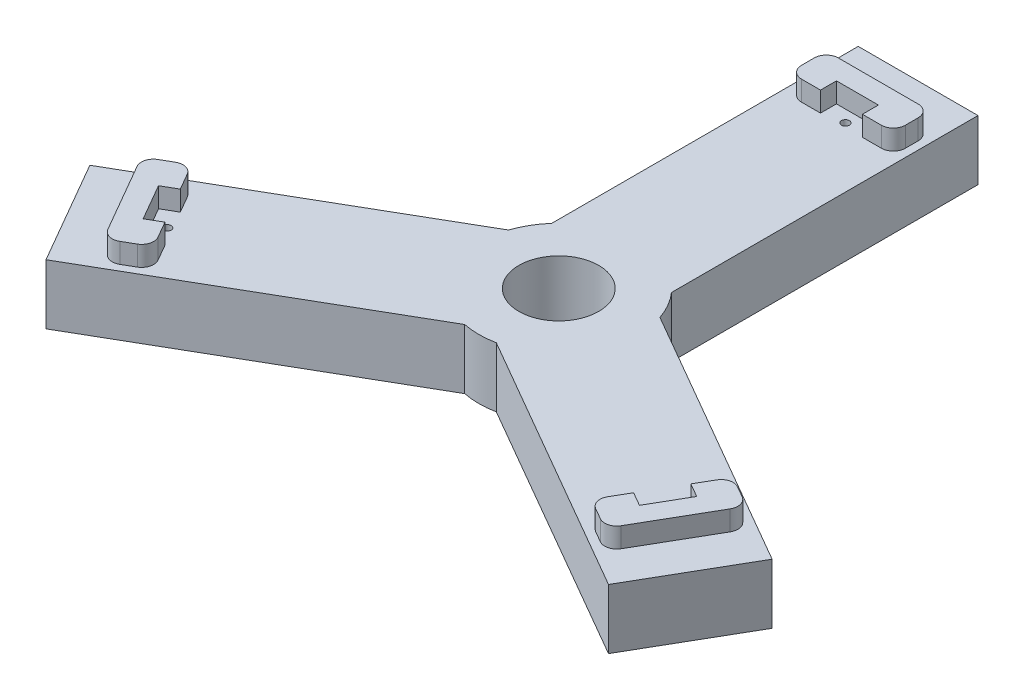
from build123d import *

# Parameters (mm, degrees)
SKETCH5_R                = 20
BOSS_EXTRUDE2_DEPTH      = 15
SKETCH6_W                = 30
SKETCH6_H                = 90
BOSS_EXTRUDE3_DEPTH      = 15
CIRPATTERN1_COUNT        = 3
BOSS_EXTRUDE4_DEPTH      = 5
FILLET1_R                = 3
SKETCH8_R                = 1
CUT_EXTRUDE1_DEPTH       = 126.001537171
SKETCH9_R                = 10
CUT_EXTRUDE2_DEPTH       = 10
CIRPATTERN4_COUNT        = 3
FILLET1_OF_CIRPATTERN4_R = 3
CIRPATTERN6_COUNT        = 3
SKETCH10_R               = 10
CUT_EXTRUDE3_DEPTH       = 126.699579534


with BuildPart() as part:
    # Sketch5 → Boss-Extrude2 (new body)
    with BuildSketch(Plane(origin=(0, 0, 0), x_dir=(1, 0, 0), z_dir=(0, 1, 0))):
        Circle(SKETCH5_R)
    extrude(amount=BOSS_EXTRUDE2_DEPTH)

    # Sketch6 → Boss-Extrude3 (add)
    with BuildSketch(Plane(origin=(0, 0, 0), x_dir=(1, 0, 0), z_dir=(0, 1, 0))):
        with Locations((0, 45)):
            Rectangle(SKETCH6_W, SKETCH6_H)
    boss_extrude3 = extrude(amount=BOSS_EXTRUDE3_DEPTH)

    # CirPattern1: Boss-Extrude3 ×3 about axis
    cirpattern1_axis = Axis((0, 15, 0), (0, -1, 0))
    for i in range(1, CIRPATTERN1_COUNT):
        add(boss_extrude3.rotate(cirpattern1_axis, i * 360 / CIRPATTERN1_COUNT))

    # Sketch7 → Boss-Extrude4 (add)
    with BuildSketch(Plane(origin=(0, 15, 0), x_dir=(1, 0, 0), z_dir=(0, 1, 0))):
        Polygon((-13, 80), (13, 80), (13, 70.8), (5.25, 70.8), (5.25, 74.8), (-5.25, 74.8), (-5.25, 70.8), (-13, 70.8), align=None)
    boss_extrude4 = extrude(amount=BOSS_EXTRUDE4_DEPTH)

    # Fillet1
    fillet1_edges = [part.edges().sort_by_distance(p)[0] for p in [
        (13, 17.5, -70.8),
        (13, 17.5, -80),
        (-13, 17.5, -70.8),
        (-13, 17.5, -80),
    ]]
    fillet(fillet1_edges, radius=FILLET1_R)

    # Sketch8 → Cut-Extrude1 (cut, through all)
    with BuildSketch(Plane(origin=(0, 15, 0), x_dir=(1, 0, 0), z_dir=(0, 1, 0))):
        with Locations((0, 71.8)):
            Circle(SKETCH8_R)
    cut_extrude1 = extrude(amount=-CUT_EXTRUDE1_DEPTH, mode=Mode.SUBTRACT)

    # Sketch9 → Cut-Extrude2 (cut)
    with BuildSketch(Plane.XZ):
        with Locations((0, -71.8)):
            Circle(SKETCH9_R)
    cut_extrude2 = extrude(amount=-CUT_EXTRUDE2_DEPTH, mode=Mode.SUBTRACT)

    # CirPattern4: Boss-Extrude4 ×3 about axis
    cirpattern4_axis = Axis((0, 15, 0), (0, -1, 0))
    for i in range(1, CIRPATTERN4_COUNT):
        add(boss_extrude4.rotate(cirpattern4_axis, i * 360 / CIRPATTERN4_COUNT))

    # Fillet1 of CirPattern4
    fillet1_of_cirpattern4_edges = [part.edges().sort_by_distance(p)[0] for p in [
        (54.814598588, 17.5, 46.658330249),
        (62.782032303, 17.5, 51.258330249),
        (67.814598588, 17.5, 24.141669751),
        (75.782032303, 17.5, 28.741669751),
        (-67.814598588, 17.5, 24.141669751),
        (-75.782032303, 17.5, 28.741669751),
        (-54.814598588, 17.5, 46.658330249),
        (-62.782032303, 17.5, 51.258330249),
    ]]
    fillet(fillet1_of_cirpattern4_edges, radius=FILLET1_OF_CIRPATTERN4_R)

    # CirPattern6: Cut-Extrude1, Cut-Extrude2 ×3 about axis
    cirpattern6_axis = Axis((0, 15, 0), (0, -1, 0))
    add([cut_extrude1.rotate(cirpattern6_axis, i * 360 / CIRPATTERN6_COUNT) for i in range(1, CIRPATTERN6_COUNT)], mode=Mode.SUBTRACT)
    add([cut_extrude2.rotate(cirpattern6_axis, i * 360 / CIRPATTERN6_COUNT) for i in range(1, CIRPATTERN6_COUNT)], mode=Mode.SUBTRACT)

    # Sketch10 → Cut-Extrude3 (cut, through all)
    with BuildSketch(Plane.XZ):
        Circle(SKETCH10_R)
    extrude(amount=-CUT_EXTRUDE3_DEPTH, mode=Mode.SUBTRACT)


solid = part.part
